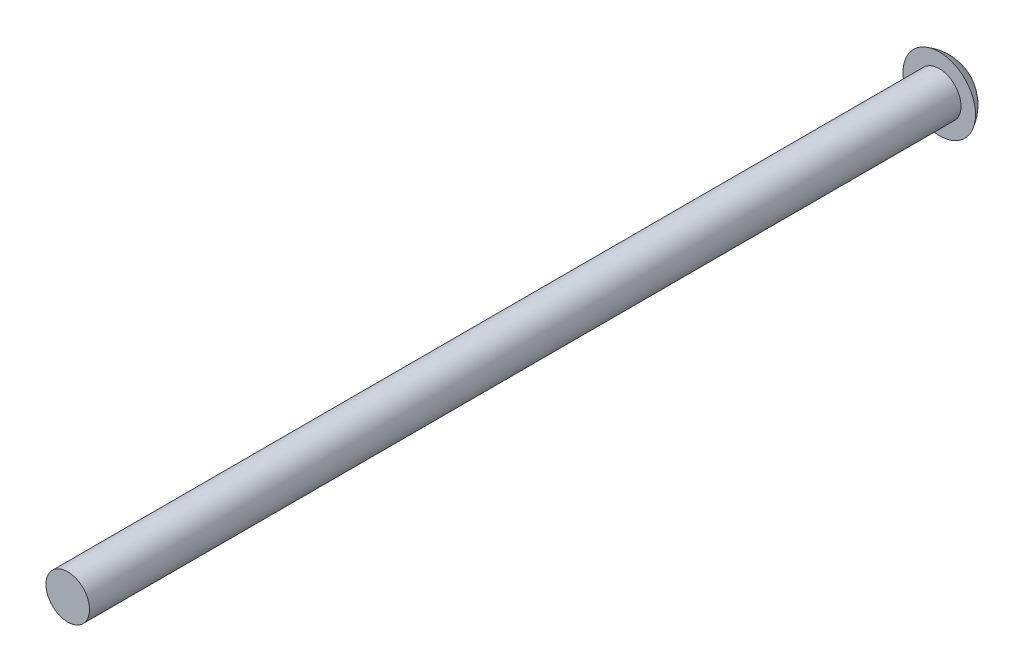
from build123d import *

# Parameters (mm, degrees)
SKETCH_1_R      = 3
EXTRUDE_1_DEPTH = 120


with BuildPart() as part:
    # 草图1 → 凸台-拉伸1 (new body)
    with BuildSketch(Plane.XY):
        Circle(SKETCH_1_R)
    extrude(amount=EXTRUDE_1_DEPTH)

    # 草图2 → 旋转1 (revolve)
    with BuildSketch(Plane(origin=(0, 0, 0), x_dir=(1, 0, 0), z_dir=(0, 1, 0))):
        with BuildLine():
            Line((0, 0), (5, 0))
            ThreePointArc((5, 0), (2.915475947, 2.192459912), (0, 3))
            Line((0, 3), (0, 0))
        make_face()
    revolve(axis=Axis((0, 0, 0), (0, 0, -1)))


solid = part.part
